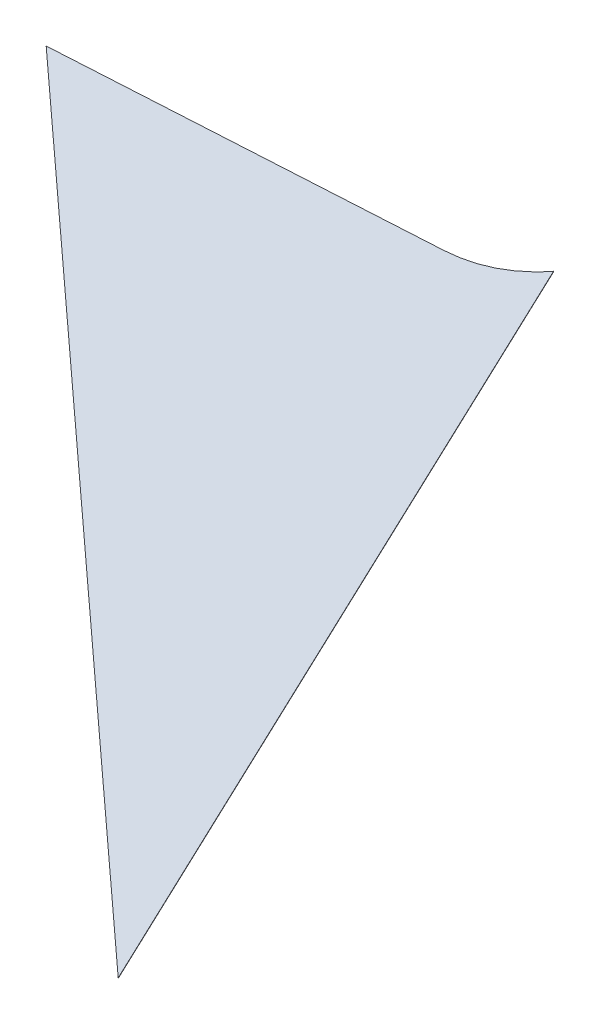
from build123d import *

# Parameters (mm, degrees)
BOSS_EXTRUDE1_DEPTH = 0.0762


with BuildPart() as part:
    # Sketch2 → Boss-Extrude1 (new, symmetric)
    with BuildSketch(Plane(origin=(-88.273967523, -606.336375081, -992.381091191), x_dir=(0.9973037560757394, 0.0712645927020255, 0.01750931021589871), z_dir=(0.0660532826209116, -0.7677995479785105, -0.6372760924269771))):
        with BuildLine():
            Line((40.522667634, 66.964251539), (198.132592229, 66.964251539))
            add(Edge.make_bspline(
                [(235, 58.209426309), (217.605890523, 66.964251539), (198.132592229, 66.964251539)],
                knots=[1.104476015, 1.104476015, 1.104476015, 1.570796327, 1.570796327, 1.570796327], degree=2, weights=[1, 0.97294109, 1]))
            Line((235, 58.209426309), (235, 287.108094093))
            Line((235, 287.108094093), (40.522667634, 66.964251539))
        make_face()
    extrude(amount=BOSS_EXTRUDE1_DEPTH, both=True)


solid = part.part
